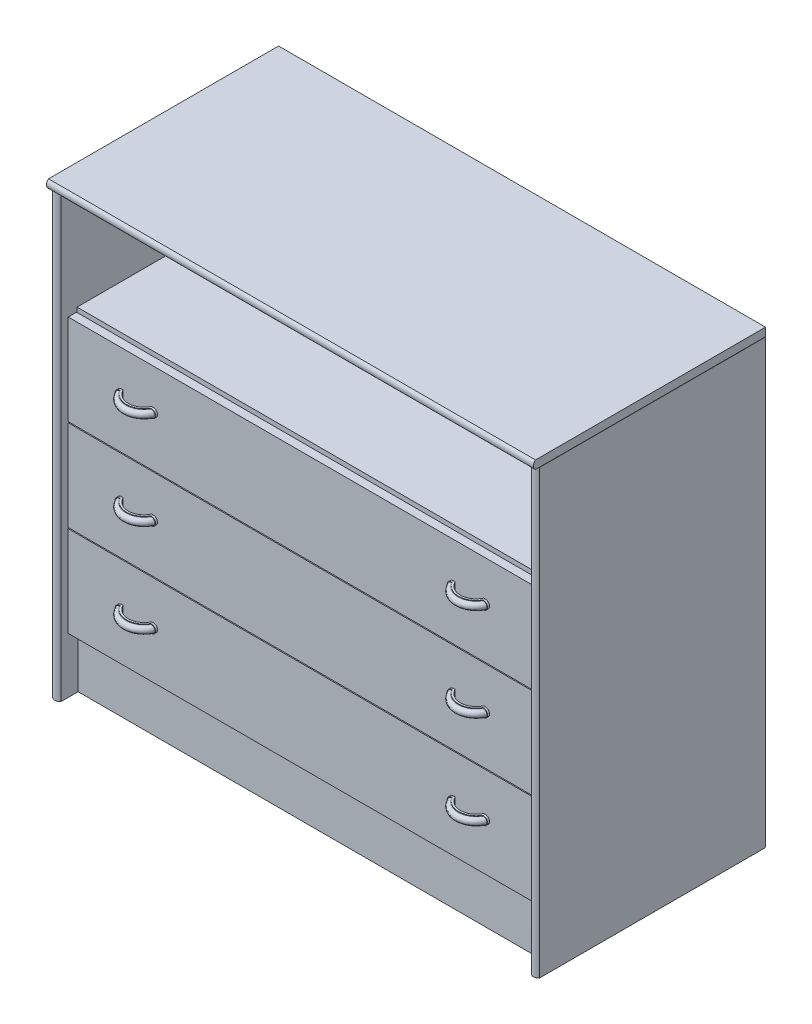
from build123d import *

# Parameters (mm, degrees)
BOSS_EXTRU_1_DEPTH              = 870
BOSS_EXTRU_2_DEPTH              = 940
ENL_V_MAT_EXTRU_1_DEPTH         = 908
ENL_V_MAT_EXTRU_2_DEPTH         = 1016.233963183
ENL_V_MAT_EXTRU_2_DEPTH_BACK    = 1016.233963183
ESQUISSE5_W                     = 8
ESQUISSE5_H                     = 0.5
BOSS_EXTRU_15_DEPTH             = 16
BOSS_EXTRU_16_DEPTH             = 16
ENL_V_MAT_EXTRU_3_DEPTH         = 1076.120458367
R_P_TITION_LIN_AIRE2_COUNT      = 3
R_P_TITION_LIN_AIRE2_PITCH      = 180
R_P_TITION_LIN_AIRE2_COUNT_DIR2 = 2
R_P_TITION_LIN_AIRE2_PITCH_DIR2 = 641


with BuildPart() as part:
    # Esquisse1 → Boss.-Extru.1 (new body)
    with BuildSketch(Plane(origin=(0, 0, 0), x_dir=(1, 0, 0), z_dir=(0, 1, 0))):
        with BuildLine():
            Line((-470, -218), (-470, 218))
            Line((-470, 218), (470, 218))
            Line((470, 218), (470, -218))
            ThreePointArc((470, -218), (462, -222), (454, -218))
            Line((454, -218), (454, -212))
            Line((454, -212), (-454, -212))
            Line((-454, -212), (-454, -218))
            ThreePointArc((-454, -218), (-462, -222), (-470, -218))
        make_face()
    extrude(amount=BOSS_EXTRU_1_DEPTH)

    # Esquisse2 → Boss.-Extru.2 (add, through all)
    with BuildSketch(Plane(origin=(470, 0, 0), x_dir=(0, 0, -1), z_dir=(1, 0, 0))):
        with BuildLine():
            Line((-196, 870), (-226, 870))
            ThreePointArc((-226, 870), (-230, 862), (-226, 854))
            Line((-226, 854), (-196, 854))
            Line((-196, 854), (-196, 870))
        make_face()
    extrude(amount=-BOSS_EXTRU_2_DEPTH)

    # Esquisse4 → Enlèv. mat.-Extru.1 (cut)
    with BuildSketch(Plane(origin=(-454, 0, 0), x_dir=(0, 0, -1), z_dir=(1, 0, 0))):
        Polygon((-218, 854), (202, 854), (202, 644), (-187, 644), (-187, 636), (-187, 634), (-188, 634), (-188, 636), (-204, 636), (-204, 461), (-187, 461), (-187, 459), (-204, 459), (-204, 284), (-187, 284), (-187, 282), (-204, 282), (-204, 107), (-185, 107), (-185, 0), (-218, 0), align=None)
    extrude(amount=ENL_V_MAT_EXTRU_1_DEPTH, mode=Mode.SUBTRACT)

    # Esquisse5 → Enlèv. mat.-Extru.2 (cut, two sides: drawn at the far end of the back side and taken through both)
    with BuildSketch(Plane.XY.offset(-ENL_V_MAT_EXTRU_2_DEPTH_BACK)):
        with Locations((-466, 853.75)):
            Rectangle(ESQUISSE5_W, ESQUISSE5_H)
        with Locations((466, 853.75)):
            Rectangle(ESQUISSE5_W, ESQUISSE5_H)
    extrude(amount=ENL_V_MAT_EXTRU_2_DEPTH + ENL_V_MAT_EXTRU_2_DEPTH_BACK, mode=Mode.SUBTRACT)

    # Balayage5: sweep along a curve in space
    with BuildLine() as balayage5_path:
        ThreePointArc((-348, 559, 204), (-320.5, 559, 221.5), (-293, 559, 204))
        ThreePointArc((-293, 559, 204), (-290.651665522, 559, 196.677570445), (-290.218581841, 559, 189))
    # Esquisse6 → Balayage5 (sweep)
    with BuildSketch(Plane.XY.offset(204)):
        with BuildLine():
            Line((-348, 567), (-348, 551))
            Line((-348, 551), (-353, 551))
            ThreePointArc((-353, 551), (-361, 559), (-353, 567))
            Line((-353, 567), (-348, 567))
        make_face()
    balayage5 = sweep(path=balayage5_path.line)

    # Enlèvement de matière-Balayage1: sweep along a curve in space
    with BuildLine() as enl_vement_de_mati_re_balayage1_path:
        ThreePointArc((-348, 559, 204), (-320.5, 559, 221.5), (-293, 559, 204))
        ThreePointArc((-293, 559, 204), (-290.651665522, 559, 196.677570445), (-290.218581841, 559, 189))
    # Esquisse8 → Enlèvement de matière-Balayage1 (sweep, cut)
    with BuildSketch(Plane.XY.offset(204)):
        with BuildLine():
            Line((-353, 567), (-352, 567))
            Line((-352, 567), (-352, 566))
            Line((-352, 566), (-353, 566))
            ThreePointArc((-353, 566), (-360, 559), (-353, 552))
            Line((-353, 552), (-352, 552))
            Line((-352, 552), (-352, 551))
            Line((-352, 551), (-353, 551))
            ThreePointArc((-353, 551), (-361, 559), (-353, 567))
        make_face()
    enl_vement_de_mati_re_balayage1 = sweep(path=enl_vement_de_mati_re_balayage1_path.line, mode=Mode.SUBTRACT)

    # Esquisse10 → Boss.-Extru.15 (add)
    with BuildSketch(Plane(origin=(0, 567, 0), x_dir=(1, 0, 0), z_dir=(0, 1, 0))):
        with BuildLine():
            Line((-360, -204), (-348, -204))
            Line((-348, -204), (-348, -208))
            Line((-348, -208), (-358.465679991, -208))
            Line((-358.465679991, -208), (-359.557297456, -208))
            ThreePointArc((-359.557297456, -208), (-360.354030738, -206.018743126), (-361.050334492, -204))
            Line((-361.050334492, -204), (-360, -204))
        make_face()
    boss_extru_15 = extrude(amount=-BOSS_EXTRU_15_DEPTH)

    # Esquisse13 → Boss.-Extru.16 (add)
    with BuildSketch(Plane(origin=(0, 567, 0), x_dir=(1, 0, 0), z_dir=(0, 1, 0))):
        with BuildLine():
            Line((-290.946779242, -208), (-281.494963695, -208))
            ThreePointArc((-281.494963695, -208), (-279.162410258, -200.979512916), (-278.082836676, -193.660867869))
            Line((-278.082836676, -193.660867869), (-286.484506406, -190.434113191))
            Line((-286.484506406, -190.434113191), (-290.946779242, -208))
        make_face()
    boss_extru_16 = extrude(amount=-BOSS_EXTRU_16_DEPTH)

    # Esquisse14 → Enlèv. mat.-Extru.3 (cut, through all)
    with BuildSketch(Plane.XY.offset(204)):
        with BuildLine():
            Line((-289.883127901, 567), (-280, 567))
            Line((-280, 567), (-280, 551))
            Line((-280, 551), (-289.883127901, 551))
            add(Edge.make_bspline(
                [(-289.883127901, 567), (-289.349683289, 567), (-288.822598201, 566.952284975), (-288.043941627, 566.810465183), (-287.786406367, 566.751464651), (-287.273801779, 566.608755681), (-287.018427455, 566.524765156), (-286.270309027, 566.239043039), (-285.794153932, 566.003936432), (-285.116889565, 565.585263808), (-284.897376144, 565.43474184), (-284.469548428, 565.109329146), (-284.262149952, 564.934826063), (-283.869986569, 564.570306268), (-283.683452862, 564.379019251), (-283.330413244, 563.978827896), (-283.164613863, 563.770904803), (-282.850993881, 563.334209303), (-282.704857426, 563.106925687), (-282.436157131, 562.638562337), (-282.313090634, 562.396352353), (-281.98665138, 561.661347163), (-281.819766543, 561.151515893), (-281.649178488, 560.355113242), (-281.606178808, 560.085604062), (-281.549126831, 559.549002923), (-281.534736934, 559.280289632), (-281.533921037, 558.743185785), (-281.547431289, 558.474865643), (-281.603089203, 557.936178052), (-281.645495822, 557.665994259), (-281.813039371, 556.872531827), (-281.978204583, 556.361357764), (-282.413085781, 555.374957039), (-282.684806193, 554.899604253), (-283.306907701, 554.028642859), (-283.66091718, 553.625308507), (-284.45076563, 552.888603856), (-284.876835268, 552.564369959), (-285.554858542, 552.143401258), (-285.787466305, 552.013907498), (-286.267652353, 551.775871516), (-286.514599828, 551.667868217), (-287.260447717, 551.382387506), (-287.770167302, 551.2401098), (-288.814406509, 551.04851073), (-289.348399835, 551), (-289.883127901, 551)],
                knots=[0, 0, 0, 0, 0.0625, 0.0625, 0.09375, 0.09375, 0.125, 0.125, 0.1875, 0.1875, 0.21875, 0.21875, 0.25, 0.25, 0.28125, 0.28125, 0.3125, 0.3125, 0.34375, 0.34375, 0.375, 0.375, 0.4375, 0.4375, 0.46875, 0.46875, 0.5, 0.5, 0.53125, 0.53125, 0.5625, 0.5625, 0.625, 0.625, 0.6875, 0.6875, 0.75, 0.75, 0.8125, 0.8125, 0.84375, 0.84375, 0.875, 0.875, 0.9375, 0.9375, 1, 1, 1, 1], degree=3))
        make_face()
        with BuildLine():
            Line((-351.116872099, 567), (-361.050334492, 567))
            Line((-361.050334492, 567), (-361.050334492, 551))
            Line((-361.050334492, 551), (-351.116872099, 551))
            add(Edge.make_bspline(
                [(-351.116872099, 567), (-351.650316711, 567), (-352.177401799, 566.952284975), (-352.956058373, 566.810465183), (-353.213593633, 566.751464651), (-353.726198221, 566.608755681), (-353.981572545, 566.524765156), (-354.729690973, 566.239043039), (-355.205846068, 566.003936432), (-355.883110435, 565.585263808), (-356.102623856, 565.43474184), (-356.530451572, 565.109329146), (-356.737850048, 564.934826063), (-357.130013431, 564.570306268), (-357.316547138, 564.379019251), (-357.669586756, 563.978827896), (-357.835386137, 563.770904803), (-358.149006119, 563.334209303), (-358.295142574, 563.106925687), (-358.563842869, 562.638562337), (-358.686909366, 562.396352353), (-359.01334862, 561.661347163), (-359.180233457, 561.151515893), (-359.350821512, 560.355113242), (-359.393821192, 560.085604062), (-359.450873169, 559.549002923), (-359.465263066, 559.280289632), (-359.466078963, 558.743185785), (-359.452568711, 558.474865643), (-359.396910797, 557.936178052), (-359.354504178, 557.665994259), (-359.186960629, 556.872531827), (-359.021795417, 556.361357764), (-358.586914219, 555.374957039), (-358.315193807, 554.899604253), (-357.693092299, 554.028642859), (-357.33908282, 553.625308507), (-356.54923437, 552.888603856), (-356.123164732, 552.564369959), (-355.445141458, 552.143401258), (-355.212533695, 552.013907498), (-354.732347647, 551.775871516), (-354.485400172, 551.667868217), (-353.739552283, 551.382387506), (-353.229832698, 551.2401098), (-352.185593491, 551.04851073), (-351.651600165, 551), (-351.116872099, 551)],
                knots=[0, 0, 0, 0, 0.0625, 0.0625, 0.09375, 0.09375, 0.125, 0.125, 0.1875, 0.1875, 0.21875, 0.21875, 0.25, 0.25, 0.28125, 0.28125, 0.3125, 0.3125, 0.34375, 0.34375, 0.375, 0.375, 0.4375, 0.4375, 0.46875, 0.46875, 0.5, 0.5, 0.53125, 0.53125, 0.5625, 0.5625, 0.625, 0.625, 0.6875, 0.6875, 0.75, 0.75, 0.8125, 0.8125, 0.84375, 0.84375, 0.875, 0.875, 0.9375, 0.9375, 1, 1, 1, 1], degree=3))
        make_face()
    enl_v_mat_extru_3 = extrude(amount=ENL_V_MAT_EXTRU_3_DEPTH, mode=Mode.SUBTRACT)

    # Répétition linéaire2: Balayage5, Enlèvement de matière-Balayage1, Boss.-Extru.15, Boss.-Extru.16, Enl_v. mat.-Extru.3 3 × 2
    with Locations(*[(j * R_P_TITION_LIN_AIRE2_PITCH_DIR2, -i * R_P_TITION_LIN_AIRE2_PITCH, 0) for i in range(R_P_TITION_LIN_AIRE2_COUNT) for j in range(R_P_TITION_LIN_AIRE2_COUNT_DIR2) if (i, j) != (0, 0)]):
        add(balayage5)
        add(enl_vement_de_mati_re_balayage1, mode=Mode.SUBTRACT)
        add(boss_extru_15)
        add(boss_extru_16)
        add(enl_v_mat_extru_3, mode=Mode.SUBTRACT)


solid = part.part
